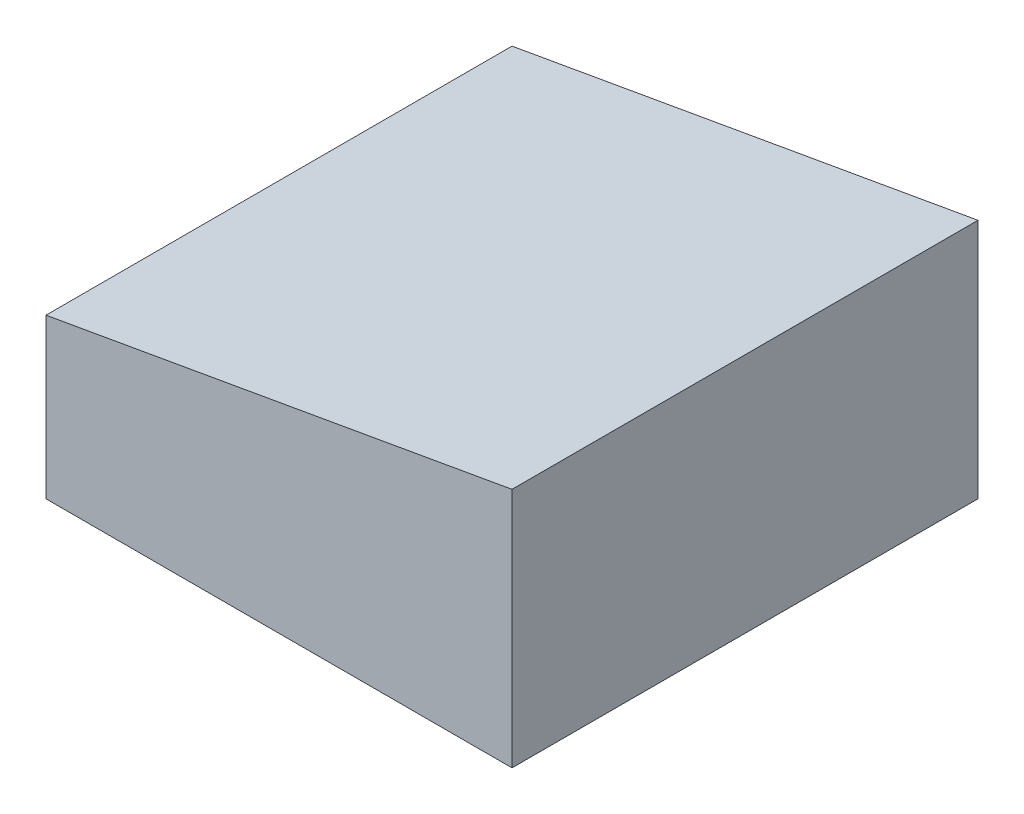
from build123d import *

# Parameters (mm, degrees)
BOSS_EXTRUDE1_DEPTH = 50.8


with BuildPart() as part:
    # Sketch1 → Boss-Extrude1 (new body)
    with BuildSketch(Plane.XY):
        Polygon((50.8, 26.2975709), (0, 17.34016028), (0, 0), (50.8, 0), align=None)
    extrude(amount=BOSS_EXTRUDE1_DEPTH)


solid = part.part
